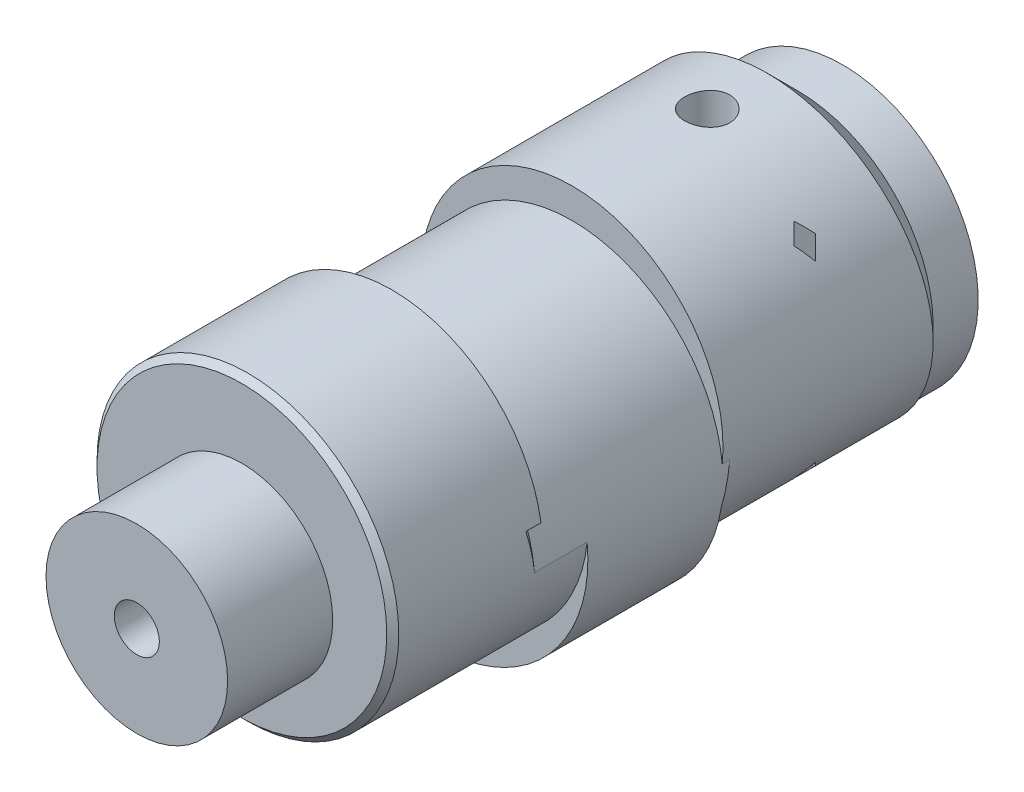
from build123d import *

# Parameters (mm, degrees)
SKETCH1_R             = 10.05
SKETCH1_R_2           = 1.5
EXTRUSION1_DEPTH      = 18
SKETCH2_R             = 10.05
SKETCH2_R_2           = 1.5
EXTRUSION2_DEPTH      = 13
SKETCH3_R             = 10.05
SKETCH3_R_2           = 1.5
EXTRUSION3_DEPTH      = 9
EXTRUSION4_START      = -4
EXTRUSION4_DEPTH      = 4
SKETCH5_R             = 6.05
SKETCH5_R_2           = 1.5
EXTRUSION5_DEPTH      = 7
SKETCH6_R             = 3.175
SKETCH6_R_2           = 1.5
EXTRUSION6_DEPTH      = 22
EXTRUSION7_DEPTH      = 4.5
SKETCH8_W             = 1.5
SKETCH8_H             = 11.05
EXTRUSION8_DEPTH      = 50.316376633
EXTRUSION8_DEPTH_BACK = 50.316376633
CHAMFER1_SIZE         = 0.4
SKETCH12_W            = 4
SKETCH12_H            = 3
CHAMFER2_SIZE         = 1.6
CHAMFER3_SIZE         = 0.5
CHAMFER4_SIZE         = 0.5
EXTRUSION10_START     = 1
EXTRUSION10_DEPTH     = 1


with BuildPart() as part:
    # Sketch1 → Extrusion1 (new body)
    with BuildSketch(Plane.XY):
        with Locations((0, 1)):
            Circle(SKETCH1_R)
        Circle(SKETCH1_R_2, mode=Mode.SUBTRACT)
    extrude(amount=EXTRUSION1_DEPTH)

    # Sketch2 → Extrusion2 (add)
    with BuildSketch(Plane(origin=(0, 1, 18), x_dir=(1, 0, 0), z_dir=(0, 0, 1))):
        with Locations(Location((0, -2, 0), (0, 0, 174.289477772))):
            Circle(SKETCH2_R)
        with Locations((0, -1)):
            Circle(SKETCH2_R_2, mode=Mode.SUBTRACT)
    extrude(amount=EXTRUSION2_DEPTH)

    # Sketch3 → Extrusion3 (add)
    with BuildSketch(Plane(origin=(0, -1, 31), x_dir=(1, 0, 0), z_dir=(0, 0, 1))):
        with Locations(Location((0, 2, 0), (0, 0, 185.710522228))):
            Circle(SKETCH3_R)
        with Locations((0, 1)):
            Circle(SKETCH3_R_2, mode=Mode.SUBTRACT)
    extrude(amount=EXTRUSION3_DEPTH)

    # Sketch4 → Extrusion4 (cut)
    with BuildSketch(Plane(origin=(0, 1, 31), x_dir=(1, 0, 0), z_dir=(0, 0, 1)).offset(EXTRUSION4_START)):
        with BuildLine():
            ThreePointArc((-10.000124999, -1), (0, -12.05), (10.000124999, -1))
            ThreePointArc((10.000124999, -1), (0, -10.05), (-10.000124999, -1))
        make_face()
    extrude(amount=EXTRUSION4_DEPTH, mode=Mode.SUBTRACT)

    # Sketch5 → Extrusion5 (add)
    with BuildSketch(Plane(origin=(0, 1, 40), x_dir=(1, 0, 0), z_dir=(0, 0, 1))):
        with Locations((0, -1)):
            Circle(SKETCH5_R)
        with Locations((0, -1)):
            Circle(SKETCH5_R_2, mode=Mode.SUBTRACT)
    extrude(amount=EXTRUSION5_DEPTH)

    # Sketch6 → Extrusion6 (cut)
    with BuildSketch(Plane(origin=(0, 1, 0), x_dir=(-1, 0, 0), z_dir=(0, 0, -1))):
        with Locations((0, -1)):
            Circle(SKETCH6_R)
        with Locations((0, -1)):
            Circle(SKETCH6_R_2, mode=Mode.SUBTRACT)
    extrude(amount=-EXTRUSION6_DEPTH, mode=Mode.SUBTRACT)

    # Sketch7 → Extrusion7 (cut)
    with BuildSketch(Plane(origin=(0, 0, 0), x_dir=(-1, 0, 0), z_dir=(0, 1, 0))):
        Polygon((-2.75, 7.41228676), (-2.75, 10.58771324), (0, 12.175426481), (2.75, 10.58771324), (2.75, 7.41228676), (0, 5.824573519), align=None)
    extrude(amount=EXTRUSION7_DEPTH, mode=Mode.SUBTRACT)

    # Sketch8 → Hole2 (revolve, cut)
    with BuildSketch(Plane(origin=(0, 0, 9), x_dir=(0, 0, -1), z_dir=(1, 0, 0))):
        with Locations((0.75, 5.525)):
            Rectangle(SKETCH8_W, SKETCH8_H)
    revolve(axis=Axis((0, 110, 9), (0, -1, 0)), mode=Mode.SUBTRACT)

    # Sketch10 → Extrusion8 (cut, two sides: drawn at the far end of the back side and taken through both)
    with BuildSketch(Plane(origin=(0, 0, 0), x_dir=(-1, 0, 0), z_dir=(0, 1, 0)).offset(-EXTRUSION8_DEPTH_BACK)):
        Polygon((-7.5, 10.707106781), (-8.207106781, 10), (-7.5, 9.292893219), (-6.792893219, 10), align=None)
        Polygon((7.5, 10.707106781), (6.792893219, 10), (7.5, 9.292893219), (8.207106781, 10), align=None)
    extrude(amount=EXTRUSION8_DEPTH + EXTRUSION8_DEPTH_BACK, mode=Mode.SUBTRACT)

    # Chamfer1
    chamfer1_edges = [part.edges().sort_by_distance(p)[0] for p in [
        (10.000124999, 2, 40),
    ]]
    chamfer(chamfer1_edges, length=CHAMFER1_SIZE)

    # Sketch12 → Revolution1 (revolve, cut)
    with BuildSketch(Plane.YZ, mode=Mode.PRIVATE) as revolution1_sk:
        with Locations((-11.05, 1.5)):
            Rectangle(SKETCH12_W, SKETCH12_H)
        Polygon((-9.05, 3), (-13.05, 7), (-13.05, 3), align=None)
    revolve(revolution1_sk.sketch.rotate(Axis((0, 0, -4.4), (0, 0, 1)), 270), axis=Axis((0, 0, -4.4), (0, 0, 1)), mode=Mode.SUBTRACT)

    # Chamfer2
    chamfer2_edges = [part.edges().sort_by_distance(p)[0] for p in [
        (-1.5, 0, 22),
    ]]
    chamfer(chamfer2_edges, length=CHAMFER2_SIZE)

    # Chamfer3
    # the kernel refuses this chamfer: 0.5 mm, written as the material it adds along each edge
    with BuildSketch(Plane(origin=(0, -1, 31), x_dir=(0.9995951137043791, -0.028453622938550055, 0), z_dir=(-0.028453622938550055, -0.9995951137043791, 0))) as chamfer3_piece_1_section:
        Polygon((10.05, -CHAMFER3_SIZE), (10.05 + CHAMFER3_SIZE, 0), (10.05, 0), align=None)
    chamfer3_piece_1 = revolve(axis=Axis((0, -1, 31), (0, 0, 1)), revolution_arc=183.260985134, mode=Mode.PRIVATE)
    chamfer3_piece_1 = chamfer3_piece_1 & Plane(origin=(0, 1, 30.761134514), x_dir=(-0.9950373133554516, -0.09950248755867733, 0), z_dir=(0, 0, -1)) * Cylinder(10.05, 43, mode=Mode.PRIVATE)
    add(chamfer3_piece_1)

    # Chamfer4
    # the kernel refuses this chamfer: 0.5 mm, written as the material it adds along each edge
    with BuildSketch(Plane(origin=(0, 1, 18), x_dir=(-0.9995951137044771, 0.028453622935110102, 0), z_dir=(0.028453622935110102, 0.9995951137044771, 0))) as chamfer4_piece_1_section:
        Polygon((10.05 + CHAMFER4_SIZE, 0), (10.05, -CHAMFER4_SIZE), (10.05, 0), align=None)
    chamfer4_piece_1 = revolve(axis=Axis((0, 1, 18), (0, 0, 1)), revolution_arc=183.260985134, mode=Mode.PRIVATE)
    chamfer4_piece_1 = chamfer4_piece_1 & Plane(origin=(0, -1, 17.760783503), x_dir=(-0.9950373133554516, 0.09950248755867756, 0), z_dir=(0, 0, -1)) * Cylinder(10.05, 43, mode=Mode.PRIVATE)
    add(chamfer4_piece_1)

    # Sketch13 → Extrusion10 (add)
    with BuildSketch(Plane(origin=(0, -1, 31), x_dir=(-1, 0, 0), z_dir=(0, 0, -1)).offset(EXTRUSION10_START)):
        with BuildLine():
            ThreePointArc((9.925818606, 3.575), (0, 12.05), (-9.925818606, 3.575))
            ThreePointArc((-9.925818606, 3.575), (0, 10.55), (9.925818606, 3.575))
        make_face()
    extrude(amount=-EXTRUSION10_DEPTH)


solid = part.part
